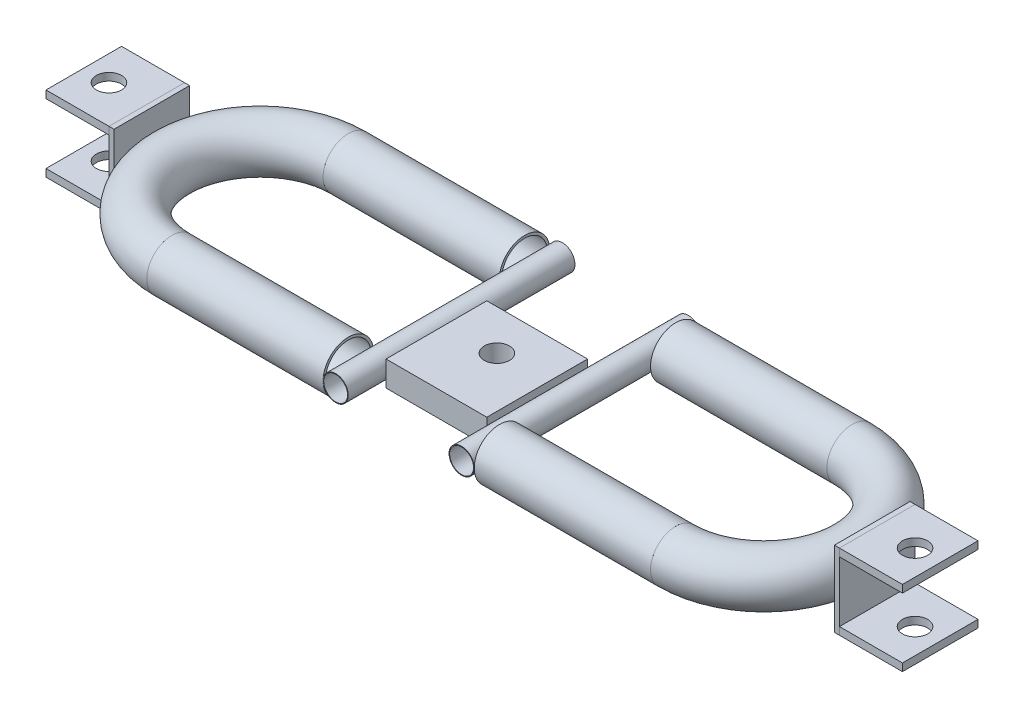
from build123d import *

# Parameters (mm, degrees)
SKETCH19_R                       = 5
SKETCH19_R_2                     = 4.75
STRUCTURAL_MEMBER2_DEPTH         = 90
STRUCTURAL_START                 = 30
STRUCTURAL_MEMBER1_OUTLINE_R     = 10
STRUCTURAL_MEMBER1_OUTLINE_R_2   = 9
STRUCTURAL_MEMBER1_DEPTH         = 70
STRUCTURAL_MEMBER1_2_OUTLINE_R   = 10
STRUCTURAL_MEMBER1_2_OUTLINE_R_2 = 9
STRUCTURAL_MEMBER1_2_ANGLE       = 180
STRUCTURAL_MEMBER1_3_OUTLINE_R   = 10
STRUCTURAL_MEMBER1_3_OUTLINE_R_2 = 9
STRUCTURAL_MEMBER1_3_DEPTH       = 70
SKETCH13_W                       = 30
SKETCH13_H                       = 30
BOSS_EXTRUDE2_DEPTH              = 2
SKETCH15_W                       = 30
SKETCH15_H                       = 3
BOSS_EXTRUDE3_DEPTH              = 25
BOSS_EXTRUDE3_2_DEPTH            = 25
SKETCH16_R                       = 5
CUT_EXTRUDE2_DEPTH               = 179.395627749
SKETCH20_W                       = 40
SKETCH20_H                       = 40
SKETCH20_R                       = 5
BOSS_EXTRUDE4_DEPTH              = 5


# Read off the part's stored shape, not the designer's step: Structural Member1
with BuildPart() as part:
    # Sketch19 → Structural Member2 (new body)
    with BuildSketch(Plane(origin=(25, 0, -45), x_dir=(1, 0, 0), z_dir=(0, 0, 1))):
        Circle(SKETCH19_R)
        Circle(SKETCH19_R_2, mode=Mode.SUBTRACT)
    extrude(amount=STRUCTURAL_MEMBER2_DEPTH)


with BuildPart() as body_2:
    # Structural Member1 outline → Structural Member1 (new body)
    with BuildSketch(Plane.YZ.offset(STRUCTURAL_START)):
        with Locations((0, -35)):
            Circle(STRUCTURAL_MEMBER1_OUTLINE_R)
        with Locations((0, -35)):
            Circle(STRUCTURAL_MEMBER1_OUTLINE_R_2, mode=Mode.SUBTRACT)
    extrude(amount=STRUCTURAL_MEMBER1_DEPTH)


with BuildPart() as body_3:
    # Structural Member1 2 outline → Structural Member1 2 (revolve)
    with BuildSketch(Plane.ZY.offset(-100)):
        with Locations((35, 0)):
            Circle(STRUCTURAL_MEMBER1_2_OUTLINE_R)
        with Locations((35, 0)):
            Circle(STRUCTURAL_MEMBER1_2_OUTLINE_R_2, mode=Mode.SUBTRACT)
    revolve(axis=Axis((100, 0, 0), (0, 1, 0)), revolution_arc=STRUCTURAL_MEMBER1_2_ANGLE)


with BuildPart() as body_4:
    # Structural Member1 3 outline → Structural Member1 3 (new body)
    with BuildSketch(Plane.YZ.offset(STRUCTURAL_START)):
        with Locations((0, 35)):
            Circle(STRUCTURAL_MEMBER1_3_OUTLINE_R)
        with Locations((0, 35)):
            Circle(STRUCTURAL_MEMBER1_3_OUTLINE_R_2, mode=Mode.SUBTRACT)
    extrude(amount=STRUCTURAL_MEMBER1_3_DEPTH)


with BuildPart() as body_5:
    # Mirror1: mirrored copy
    add(part.part.mirror(Plane(origin=(0, 0, 0), x_dir=(0, 0, 1), z_dir=(1, 0, 0))))


with BuildPart() as body_6:
    # Mirror1 2: mirrored copy
    add(body_2.part.mirror(Plane(origin=(0, 0, 0), x_dir=(0, 0, 1), z_dir=(1, 0, 0))))


with BuildPart() as body_7:
    # Mirror1 3: mirrored copy
    add(body_3.part.mirror(Plane(origin=(0, 0, 0), x_dir=(0, 0, 1), z_dir=(1, 0, 0))))


with BuildPart() as body_8:
    # Mirror1 4: mirrored copy
    add(body_4.part.mirror(Plane(origin=(0, 0, 0), x_dir=(0, 0, 1), z_dir=(1, 0, 0))))


with BuildPart() as body_9:
    # Sketch13 → Boss-Extrude2 (new body)
    with BuildSketch(Plane(origin=(143, 0, 0), x_dir=(0, 0, -1), z_dir=(1, 0, 0))):
        Rectangle(SKETCH13_W, SKETCH13_H)
    extrude(amount=BOSS_EXTRUDE2_DEPTH)


with BuildPart() as body_10:
    # Sketch15 → Boss-Extrude3 (new body)
    with BuildSketch(Plane(origin=(145, 0, 0), x_dir=(0, 0, -1), z_dir=(1, 0, 0))):
        with Locations((0, 13.5)):
            Rectangle(SKETCH15_W, SKETCH15_H)
    extrude(amount=BOSS_EXTRUDE3_DEPTH)


with BuildPart() as body_11:
    # Sketch15 → Boss-Extrude3 2 (new body)
    with BuildSketch(Plane(origin=(145, 0, 0), x_dir=(0, 0, -1), z_dir=(1, 0, 0))):
        with Locations((0, -13.5)):
            Rectangle(SKETCH15_W, SKETCH15_H)
    extrude(amount=BOSS_EXTRUDE3_2_DEPTH)


with BuildPart() as cut_extrude2_tool:
    # Sketch16 → Cut-Extrude2 (new, through all)
    with BuildSketch(Plane(origin=(0, 15, 0), x_dir=(1, 0, 0), z_dir=(0, 1, 0))):
        with Locations(Location((160, 0, 0), (0, 0, 270))):
            Circle(SKETCH16_R)
    extrude(amount=-CUT_EXTRUDE2_DEPTH)


with BuildPart() as body_10_1:
    add(body_10.part)

    # Cut-Extrude2: cut by cut_extrude2_tool
    add(cut_extrude2_tool.part, mode=Mode.SUBTRACT)


with BuildPart() as body_11_1:
    add(body_11.part)

    # Cut-Extrude2: cut by cut_extrude2_tool
    add(cut_extrude2_tool.part, mode=Mode.SUBTRACT)


with BuildPart() as body_12:
    # Mirror2: mirrored copy
    add(body_10_1.part.mirror(Plane(origin=(0, 0, 0), x_dir=(0, 0, 1), z_dir=(1, 0, 0))))


with BuildPart() as body_13:
    # Mirror2 2: mirrored copy
    add(body_9.part.mirror(Plane(origin=(0, 0, 0), x_dir=(0, 0, 1), z_dir=(1, 0, 0))))


with BuildPart() as body_14:
    # Mirror2 3: mirrored copy
    add(body_11_1.part.mirror(Plane(origin=(0, 0, 0), x_dir=(0, 0, 1), z_dir=(1, 0, 0))))


with BuildPart() as body_15:
    # Sketch20 → Boss-Extrude4 (new, symmetric)
    with BuildSketch(Plane(origin=(0, 0, 0), x_dir=(1, 0, 0), z_dir=(0, 1, 0))):
        with Locations((0, -10)):
            Rectangle(SKETCH20_W, SKETCH20_H)
        with Locations(Location((0, -6, 0), (0, 0, 270))):
            Circle(SKETCH20_R, mode=Mode.SUBTRACT)
    extrude(amount=BOSS_EXTRUDE4_DEPTH, both=True)


solid = Compound([part.part, body_2.part, body_3.part, body_4.part, body_5.part, body_6.part, body_7.part, body_8.part, body_9.part, body_10_1.part, body_11_1.part, body_12.part, body_13.part, body_14.part, body_15.part])
